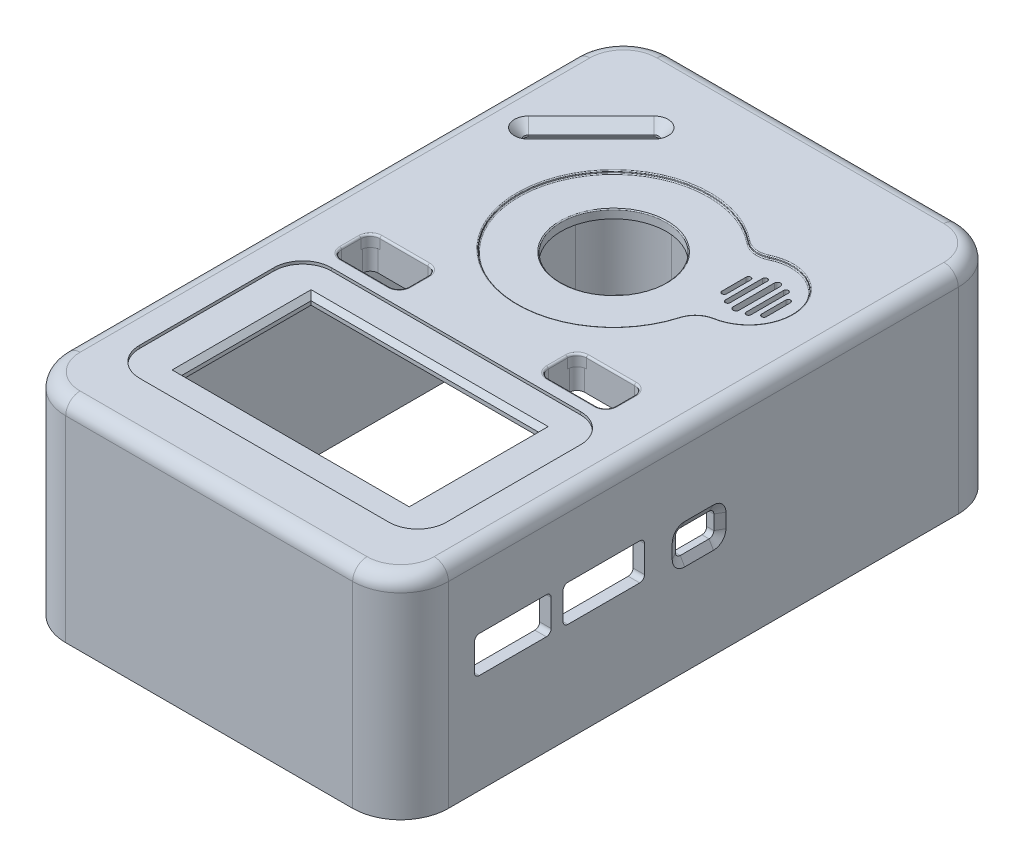
from build123d import *

# Parameters (mm, degrees)
SKETCH_1_W              = 39.94
SKETCH_1_H              = 63.19
EXTRUDE_1_DEPTH         = 22
SHELL_1_T               = -1.2
SKETCH_2_R              = 2.25
SKETCH_2_R_2            = 1.5
EXTRUDE_2_DEPTH         = 5.9
SKETCH_3_R              = 5.5
CUT_EXTRUDE_2_DEPTH     = 43.774816481
SKETCH_4_W              = 7
SKETCH_4_H              = 4
CUT_EXTRUDE_1228_DEPTH  = 44.371014803
SKETCH_5_W              = 8
SKETCH_5_H              = 3.8
SKETCH_5_W_2            = 8.5
SWD_DEPTH               = 10
FILLET_4_R              = 5
FILLET_5_R              = 1.5
FILLET_7_R              = 0.5
CUT_EXTRUDE_6_DEPTH     = 2
CHAMFER_1_SIZE          = 1
CUT_EXTRUDE_9_DEPTH     = 1.2
CUT_EXTRUDE_13_DEPTH    = 1.2
FILLET_8_R              = 1
CUT_EXTRUDE_14_DEPTH    = 1.2
SKETCH_21_R             = 4.003359422
SKETCH_21_R_2           = 3.473256356
EXTRUDE_4_DEPTH         = 3
CUT_EXTRUDE_15_DEPTH    = 0.3
FILLET_9_R              = 0.1
FILLET_10_R             = 0.2
EXTRUDE_5_DEPTH         = 3
CHAMFER_3_SIZE          = 0.141061585
CHAMFER_3_SIZE_2        = 0.8
SKETCH_37_W             = 32
SKETCH_37_H             = 20
SKETCH_37_W_2           = 23.74
SKETCH_37_H_2           = 13.5
CUT_EXTRUDE_10086_DEPTH = 0.3
FILLET_11_R             = 3
SKETCH_38_W             = 23.74
SKETCH_38_H             = 13.5
CUT_EXTRUDE_18_DEPTH    = 44.371014875
CHAMFER_4_SIZE          = 0.5
FILLET_12_R             = 0.5
SKETCH_39_W             = 4
SKETCH_39_H             = 2.5
CUT_EXTRUDE_11267_DEPTH = 1.2
FILLET_13_R             = 0.5
CHAMFER_5_SIZE          = 0.8
CHAMFER_5_SIZE2         = 0.461880215
SKETCH_40_W             = 8
SKETCH_40_H             = 5
SKETCH_40_W_2           = 7
SKETCH_40_H_2           = 4
EXTRUDE_6_DEPTH         = 2.2
FILLET_14_R             = 0.8
FILLET_15_R             = 0.8
CUT_EXTRUDE_22_DEPTH    = 72.001181358
CHAMFER_9_SIZE          = 1.430104311
CHAMFER_9_SIZE2         = 1.2
CHAMFER_10_SIZE         = 1.2
CHAMFER_10_SIZE2        = 1.430104311


with BuildPart() as part:
    # 草图1 → 凸台-拉伸1 (new body)
    with BuildSketch(Plane(origin=(0, 0, 0), x_dir=(1, 0, 0), z_dir=(0, 1, 0))):
        Rectangle(SKETCH_1_W, SKETCH_1_H)
    extrude(amount=EXTRUDE_1_DEPTH)

    # 抽壳1
    shell_1_openings = [part.faces().sort_by_distance(p)[0] for p in [
        (0, 0, 0),
    ]]
    offset(amount=SHELL_1_T, openings=shell_1_openings, kind=Kind.INTERSECTION)

    # 草图2 → 凸台-拉伸2 (add)
    # profile 1 of 3: a face of its own
    with BuildSketch(Plane.XZ.offset(-20.8)):
        with Locations(Location((-14.97, 23.095, 0), (0, 0, 270))):
            Circle(SKETCH_2_R)
        with Locations(Location((-14.97, 23.095, 0), (0, 0, 270))):
            Circle(SKETCH_2_R_2, mode=Mode.SUBTRACT)
    # profile 2 of 3: a face of its own
    with BuildSketch(Plane.XZ.offset(-20.8)):
        with Locations(Location((-14.97, -23.115, 0), (0, 0, 270))):
            Circle(SKETCH_2_R)
        with Locations(Location((-14.97, -23.115, 0), (0, 0, 270))):
            Circle(SKETCH_2_R_2, mode=Mode.SUBTRACT)
    # profile 3 of 3: a face of its own
    with BuildSketch(Plane.XZ.offset(-20.8)):
        with Locations(Location((14.98, -23.115, 0), (0, 0, 270))):
            Circle(SKETCH_2_R)
        with Locations(Location((14.98, -23.115, 0), (0, 0, 270))):
            Circle(SKETCH_2_R_2, mode=Mode.SUBTRACT)
    extrude(amount=EXTRUDE_2_DEPTH)

    # 草图3 → 切除-拉伸2 (cut, through all)
    with BuildSketch(Plane(origin=(0, 20.8, 0), x_dir=(-1, 0, 0), z_dir=(0, -1, 0))):
        with Locations(Location((0, 10.602, 0), (0, 0, 90))):
            Circle(SKETCH_3_R)
    extrude(amount=-CUT_EXTRUDE_2_DEPTH, mode=Mode.SUBTRACT)

    # 草图4 → Cut-Extrude 1228 (cut, through all)
    with BuildSketch(Plane(origin=(0, 22, 0), x_dir=(1, 0, 0), z_dir=(0, 1, 0))):
        with Locations((10.78218, -2.49486)):
            Rectangle(SKETCH_4_W, SKETCH_4_H)
        with Locations((-10.78218, -2.49486)):
            Rectangle(SKETCH_4_W, SKETCH_4_H)
    extrude(amount=-CUT_EXTRUDE_1228_DEPTH, mode=Mode.SUBTRACT)

    # 草图5 → swd (cut)
    with BuildSketch(Plane(origin=(19.97, 0, 0), x_dir=(0, 0, -1), z_dir=(1, 0, 0))):
        with Locations((-19.885, 12.3)):
            Rectangle(SKETCH_5_W, SKETCH_5_H)
        with Locations((-10.395, 12.3)):
            Rectangle(SKETCH_5_W_2, SKETCH_5_H)
    extrude(amount=-SWD_DEPTH, mode=Mode.SUBTRACT)

    # 圆角4
    fillet_4_edges = [part.edges().sort_by_distance(p)[0] for p in [
        (18.77, 10.4, 30.395),
        (18.77, 10.4, -30.395),
        (-18.77, 10.4, -30.395),
        (-18.77, 10.4, 30.395),
        (19.97, 11, 31.595),
        (-19.97, 11, 31.595),
        (-19.97, 11, -31.595),
        (19.97, 11, -31.595),
    ]]
    fillet(fillet_4_edges, radius=FILLET_4_R)

    # 圆角5
    fillet_5_edges = [part.edges().sort_by_distance(p)[0] for p in [
        (18.77, 20.8, 0),
        (0, 20.8, -30.395),
        (0, 20.8, 30.395),
        (-18.77, 20.8, 0),
        (-17.305533906, 20.8, 28.930533906),
        (17.305533906, 20.8, 28.930533906),
        (-17.305533906, 20.8, -28.930533906),
        (17.305533906, 20.8, -28.930533906),
        (0, 22, -31.595),
        (19.97, 22, 0),
        (-19.97, 22, 0),
        (0, 22, 31.595),
        (18.505533906, 22, 30.130533906),
        (-18.505533906, 22, 30.130533906),
        (-18.505533906, 22, -30.130533906),
        (18.505533906, 22, -30.130533906),
    ]]
    fillet(fillet_5_edges, radius=FILLET_5_R)

    # 圆角7
    fillet_7_edges = [part.edges().sort_by_distance(p)[0] for p in [
        (19.37, 14.2, 15.885),
        (19.37, 10.4, 15.885),
        (19.37, 10.4, 23.885),
        (19.37, 14.2, 23.885),
    ]]
    fillet(fillet_7_edges, radius=FILLET_7_R)

    # 草图7 → 切除-拉伸6 (cut)
    with BuildSketch(Plane(origin=(0, 22, 0), x_dir=(1, 0, 0), z_dir=(0, 1, 0))):
        with BuildLine():
            Line((-15.710868493, 17.443795475), (-9.170498178, 23.984165789))
            ThreePointArc((-9.170498178, 23.984165789), (-8.493843211, 23.984165789), (-8.493843211, 23.307510822))
            Line((-8.493843211, 23.307510822), (-15.034213525, 16.767140507))
            ThreePointArc((-15.034213525, 16.767140507), (-15.710868493, 16.767140507), (-15.710868493, 17.443795475))
        make_face()
    extrude(amount=-CUT_EXTRUDE_6_DEPTH, mode=Mode.SUBTRACT)

    # 倒角1
    chamfer_1_edges = [part.edges().sort_by_distance(p)[0] for p in [
        (-15.710868493, 22, -16.767140507),
        (-11.764028368, 22, -20.037325665),
        (-8.493843211, 22, -23.984165789),
        (-12.440683335, 22, -20.713980632),
    ]]
    chamfer(chamfer_1_edges, length=CHAMFER_1_SIZE)

    # 草图9 → 切除-拉伸9 (cut)
    with BuildSketch(Plane(origin=(0, 22, 0), x_dir=(1, 0, 0), z_dir=(0, 1, 0))):
        with BuildLine():
            Line((11.195444129, 11.881592207), (11.195444129, 16.185123176))
            ThreePointArc((11.195444129, 16.185123176), (11.507696947, 16.497375994), (11.819949765, 16.185123176))
            Line((11.819949765, 16.185123176), (11.819949765, 11.881592207))
            ThreePointArc((11.819949765, 11.881592207), (11.507696947, 11.569339388), (11.195444129, 11.881592207))
        make_face()
    extrude(amount=-CUT_EXTRUDE_9_DEPTH, mode=Mode.SUBTRACT)

    # 草图11 → 切除-拉伸13 (cut)
    with BuildSketch(Plane(origin=(0, 22, 0), x_dir=(1, 0, 0), z_dir=(0, 1, 0))):
        with BuildLine():
            Line((10.167500669, 12.090149524), (10.167500669, 15.990149524))
            ThreePointArc((10.167500669, 15.990149524), (10.417500669, 16.240149524), (10.667500669, 15.990149524))
            Line((10.667500669, 15.990149524), (10.667500669, 12.090149524))
            ThreePointArc((10.667500669, 12.090149524), (10.417500669, 11.840149524), (10.167500669, 12.090149524))
        make_face()
        with BuildLine():
            Line((12.847893225, 12.090149524), (12.847893225, 15.990149524))
            ThreePointArc((12.847893225, 15.990149524), (12.597893225, 16.240149524), (12.347893225, 15.990149524))
            Line((12.347893225, 15.990149524), (12.347893225, 12.090149524))
            ThreePointArc((12.347893225, 12.090149524), (12.597893225, 11.840149524), (12.847893225, 12.090149524))
        make_face()
    extrude(amount=-CUT_EXTRUDE_13_DEPTH, mode=Mode.SUBTRACT)

    # 圆角8
    fillet_8_edges = [part.edges().sort_by_distance(p)[0] for p in [
        (7.28218, 21.4, 4.49486),
        (7.28218, 21.4, 0.49486),
        (14.28218, 21.4, 0.49486),
        (14.28218, 21.4, 4.49486),
        (-14.28218, 21.4, 4.49486),
        (-14.28218, 21.4, 0.49486),
        (-7.28218, 21.4, 0.49486),
        (-7.28218, 21.4, 4.49486),
    ]]
    fillet(fillet_8_edges, radius=FILLET_8_R)

    # 草图14 → 切除-拉伸14 (cut)
    with BuildSketch(Plane(origin=(0, 22, 0), x_dir=(1, 0, 0), z_dir=(0, 1, 0))):
        with BuildLine():
            Line((9.19032227, 12.708953483), (9.19032227, 15.237110605))
            ThreePointArc((9.19032227, 15.237110605), (9.438180812, 15.484969146), (9.686039353, 15.237110605))
            Line((9.686039353, 15.237110605), (9.686039353, 12.708953483))
            ThreePointArc((9.686039353, 12.708953483), (9.438180812, 12.461094942), (9.19032227, 12.708953483))
        make_face()
        with BuildLine():
            Line((13.825071623, 12.708953483), (13.825071623, 15.237110605))
            ThreePointArc((13.825071623, 15.237110605), (13.577213082, 15.484969146), (13.329354541, 15.237110605))
            Line((13.329354541, 15.237110605), (13.329354541, 12.708953483))
            ThreePointArc((13.329354541, 12.708953483), (13.577213082, 12.461094942), (13.825071623, 12.708953483))
        make_face()
    extrude(amount=-CUT_EXTRUDE_14_DEPTH, mode=Mode.SUBTRACT)

    # 草图21 → 凸台-拉伸4 (add)
    with BuildSketch(Plane.XZ.offset(-20.8)):
        with Locations(Location((11.482348842, -14.033357691, 0), (0, 0, 270))):
            Circle(SKETCH_21_R)
        with Locations(Location((11.482348842, -14.033357691, 0), (0, 0, 270))):
            Circle(SKETCH_21_R_2, mode=Mode.SUBTRACT)
    extrude(amount=EXTRUDE_4_DEPTH)

    # 草图28 → 切除-拉伸15 (cut)
    with BuildSketch(Plane(origin=(0, 22, 0), x_dir=(1, 0, 0), z_dir=(0, 1, 0))):
        with BuildLine():
            ThreePointArc((11.528895597, 9.570062904), (15.014572547, 15.38266374), (8.786694992, 18.056577245))
            ThreePointArc((8.786694992, 18.056577245), (7.511521234, 17.845174605), (6.321720035, 18.350280829))
            ThreePointArc((6.321720035, 18.350280829), (-9.543831568, 7.616153555), (9.610486686, 7.838208102))
            ThreePointArc((9.610486686, 7.838208102), (10.32235967, 8.978109336), (11.528895597, 9.570062904))
        make_face()
    extrude(amount=-CUT_EXTRUDE_15_DEPTH, mode=Mode.SUBTRACT)

    # 圆角9
    fillet_9_edges = [part.edges().sort_by_distance(p)[0] for p in [
        (0, 21.7, -5.102),
        (7.511521234, 22, -17.845174605),
        (-9.543831568, 22, -7.616153555),
        (10.32235967, 22, -8.978109336),
        (15.014572547, 22, -15.38266374),
        (7.511521234, 21.7, -17.845174605),
        (15.014572547, 21.7, -15.38266374),
        (10.32235967, 21.7, -8.978109336),
        (-9.543831568, 21.7, -7.616153555),
    ]]
    fillet(fillet_9_edges, radius=FILLET_9_R)

    # 圆角10
    fillet_10_edges = [part.edges().sort_by_distance(p)[0] for p in [
        (10.78218, 22, 0.49486),
        (14.28218, 22, 2.49486),
        (7.28218, 22, 2.49486),
        (10.78218, 22, 4.49486),
        (-14.28218, 22, 2.49486),
        (-10.78218, 22, 0.49486),
        (-7.28218, 22, 2.49486),
        (-10.78218, 22, 4.49486),
        (13.989286781, 22, 0.787753219),
        (7.575073219, 22, 0.787753219),
        (7.575073219, 22, 4.201966781),
        (13.989286781, 22, 4.201966781),
        (-13.989286781, 22, 0.787753219),
        (-7.575073219, 22, 0.787753219),
        (-7.575073219, 22, 4.201966781),
        (-13.989286781, 22, 4.201966781),
    ]]
    fillet(fillet_10_edges, radius=FILLET_10_R)

    # 草图29 → 凸台-拉伸5 (add)
    with BuildSketch(Plane.XZ.offset(-20.8)):
        with BuildLine():
            Line((-14.82513277, -15.881404785), (-7.608107488, -23.098430067))
            ThreePointArc((-7.608107488, -23.098430067), (-7.608107488, -24.869901512), (-9.379578933, -24.869901512))
            Line((-9.379578933, -24.869901512), (-16.596604215, -17.65287623))
            ThreePointArc((-16.596604215, -17.65287623), (-16.596604215, -15.881404785), (-14.82513277, -15.881404785))
        make_face()
        with BuildLine():
            Line((-15.082047517, -16.138319531), (-7.865022235, -23.355344814))
            ThreePointArc((-7.865022235, -23.355344814), (-7.865022235, -24.612986765), (-9.122664186, -24.612986765))
            Line((-9.122664186, -24.612986765), (-16.339689469, -17.395961483))
            ThreePointArc((-16.339689469, -17.395961483), (-16.339689469, -16.138319531), (-15.082047517, -16.138319531))
        make_face(mode=Mode.SUBTRACT)
    extrude(amount=EXTRUDE_5_DEPTH)

    # 倒角3
    # the kernel refuses this chamfer: 0.8, 0.141061585 mm, written as the material it takes off along each edge
    with BuildSketch(Plane(origin=(-8.493843211, 17.8, -23.984165789), x_dir=(0.7071067811865506, 0, 0.7071067811865446), z_dir=(-0.7071067811865446, 0, 0.7071067811865506))) as chamfer_3_piece_1:
        Polygon((0.889287152, CHAMFER_3_SIZE * 0.999999996929), (0.889287152 + CHAMFER_3_SIZE_2, 0), (0.889287152, 0), align=None)
    revolve(axis=Axis((-8.493843211, 17.8, -23.984165789), (0, 1, 0)), revolution_arc=180, mode=Mode.SUBTRACT)
    with BuildSketch(Plane(origin=(-9.122664186, 17.8, -24.612986765), x_dir=(0.14859054272879452, 0.9776715712462568, 0.14859054272879438), z_dir=(-0.7071067811865472, 0, 0.7071067811865479)), Plane(origin=(-15.082047517, 17.8, -16.138319531), x_dir=(-0.14859054272879452, 0.9776715712462568, -0.14859054272879435), z_dir=(0.7071067811865471, 0, -0.7071067811865479))) as chamfer_3_piece_2:
        Polygon((CHAMFER_3_SIZE * 0.977671568244, CHAMFER_3_SIZE * 0.210138760122), (-CHAMFER_3_SIZE_2 * 0.210138760767, CHAMFER_3_SIZE_2 * 0.977671571246), (0, 0), align=None)
    extrude(amount=10.206415034, mode=Mode.SUBTRACT)
    with BuildSketch(Plane(origin=(-15.710868493, 17.8, -16.767140507), x_dir=(-0.7071067811865466, 0, -0.7071067811865486), z_dir=(0.7071067811865486, 0, -0.7071067811865466))) as chamfer_3_piece_3:
        Polygon((0.889287152, CHAMFER_3_SIZE * 0.999999996929), (0.889287152 + CHAMFER_3_SIZE_2, 0), (0.889287152, 0), align=None)
    revolve(axis=Axis((-15.710868493, 17.8, -16.767140507), (0, 1, 0)), revolution_arc=180, mode=Mode.SUBTRACT)

    # 草图37 → Cut-Extrude 10086 (cut)
    with BuildSketch(Plane(origin=(0, 22, 0), x_dir=(1, 0, 0), z_dir=(0, 1, 0))):
        with Locations((0, -15.845)):
            Rectangle(SKETCH_37_W, SKETCH_37_H)
        with Locations((0, -15.845)):
            Rectangle(SKETCH_37_W_2, SKETCH_37_H_2, mode=Mode.SUBTRACT)
    extrude(amount=-CUT_EXTRUDE_10086_DEPTH, mode=Mode.SUBTRACT)

    # 圆角11
    fillet_11_edges = [part.edges().sort_by_distance(p)[0] for p in [
        (-16, 21.85, 25.845),
        (-16, 21.85, 5.845),
        (16, 21.85, 5.845),
        (16, 21.85, 25.845),
    ]]
    fillet(fillet_11_edges, radius=FILLET_11_R)

    # 草图38 → 切除-拉伸18 (cut, through all)
    with BuildSketch(Plane(origin=(0, 22, 0), x_dir=(1, 0, 0), z_dir=(0, 1, 0))):
        with Locations((0, -15.845)):
            Rectangle(SKETCH_38_W, SKETCH_38_H)
    extrude(amount=-CUT_EXTRUDE_18_DEPTH, mode=Mode.SUBTRACT)

    # 倒角4
    chamfer_4_edges = [part.edges().sort_by_distance(p)[0] for p in [
        (0, 21.7, 9.095),
        (-11.87, 21.7, 15.845),
        (0, 21.7, 22.595),
        (11.87, 21.7, 15.845),
    ]]
    chamfer(chamfer_4_edges, length=CHAMFER_4_SIZE)

    # 圆角12
    fillet_12_edges = [part.edges().sort_by_distance(p)[0] for p in [
        (19.37, 14.2, 6.145),
        (19.37, 10.4, 6.145),
        (19.37, 10.4, 14.645),
        (19.37, 14.2, 14.645),
    ]]
    fillet(fillet_12_edges, radius=FILLET_12_R)

    # 草图39 → Cut-Extrude 11267 (cut)
    with BuildSketch(Plane(origin=(19.97, 0, 0), x_dir=(0, 0, -1), z_dir=(1, 0, 0))):
        with Locations((-0.45095135, 11.55)):
            Rectangle(SKETCH_39_W, SKETCH_39_H)
    extrude(amount=-CUT_EXTRUDE_11267_DEPTH, mode=Mode.SUBTRACT)

    # 圆角13
    fillet_13_edges = [part.edges().sort_by_distance(p)[0] for p in [
        (19.37, 12.8, -1.54904865),
        (19.37, 10.3, -1.54904865),
        (19.37, 10.3, 2.45095135),
        (19.37, 12.8, 2.45095135),
    ]]
    fillet(fillet_13_edges, radius=FILLET_13_R)

    # 倒角5
    chamfer_5_edges = [part.edges().sort_by_distance(p)[0] for p in [
        (19.97, 12.8, 0.45095135),
        (19.97, 11.55, -1.54904865),
        (19.97, 10.3, 0.45095135),
        (19.97, 11.55, 2.45095135),
        (19.97, 12.653553391, -1.402602041),
        (19.97, 10.446446609, -1.402602041),
        (19.97, 10.446446609, 2.304504741),
        (19.97, 12.653553391, 2.304504741),
    ]]
    chamfer_5_side = [part.faces().sort_by_distance(p)[0] for p in [
        (19.97, 10.112151821, -0.921281886),
    ]]
    chamfer(chamfer_5_edges, length=CHAMFER_5_SIZE, length2=CHAMFER_5_SIZE2, reference=chamfer_5_side[0])

    # 草图40 → 凸台-拉伸6 (add)
    # profile 1 of 2: a face of its own
    with BuildSketch(Plane.XZ.offset(-20.8)):
        with Locations((-10.78218, 2.49486)):
            Rectangle(SKETCH_40_W, SKETCH_40_H)
        with Locations((-10.78218, 2.49486)):
            Rectangle(SKETCH_40_W_2, SKETCH_40_H_2, mode=Mode.SUBTRACT)
    # profile 2 of 2: a face of its own
    with BuildSketch(Plane.XZ.offset(-20.8)):
        with Locations((10.78218, 2.49486)):
            Rectangle(SKETCH_40_W, SKETCH_40_H)
        with Locations((10.78218, 2.49486)):
            Rectangle(SKETCH_40_W_2, SKETCH_40_H_2, mode=Mode.SUBTRACT)
    extrude(amount=EXTRUDE_6_DEPTH)

    # 圆角14
    fillet_14_edges = [part.edges().sort_by_distance(p)[0] for p in [
        (-6.78218, 19.7, -0.00514),
        (-6.78218, 19.7, 4.99486),
        (-14.78218, 19.7, 4.99486),
        (-14.78218, 19.7, -0.00514),
        (-7.28218, 19.7, 4.49486),
        (-14.28218, 19.7, 4.49486),
        (-14.28218, 19.7, 0.49486),
        (-7.28218, 19.7, 0.49486),
    ]]
    fillet(fillet_14_edges, radius=FILLET_14_R)

    # 圆角15
    fillet_15_edges = [part.edges().sort_by_distance(p)[0] for p in [
        (14.78218, 19.7, -0.00514),
        (14.78218, 19.7, 4.99486),
        (6.78218, 19.7, 4.99486),
        (6.78218, 19.7, -0.00514),
        (7.28218, 19.7, 4.49486),
        (7.28218, 19.7, 0.49486),
        (14.28218, 19.7, 0.49486),
        (14.28218, 19.7, 4.49486),
    ]]
    fillet(fillet_15_edges, radius=FILLET_15_R)

    # Sketch 3D_9 → 切除-拉伸22 (cut, through all, along a direction that is not the sketch's normal)
    with BuildSketch(Plane(origin=(-16.751307749, 8.192548867, -27.413692251), x_dir=(0.2834326041895312, 0.9161505977538402, -0.2834326041894651), z_dir=(-0.7071067811864651, 0, -0.70710678118663))):
        Polygon((0, 0), (0.506136717, 1.156830974), (1.628870738, 0.665612357), (1.122734021, -0.491218617), align=None)
        Polygon((1.521330038, -0.665612357), (2.027466755, 0.491218617), (3.150200775, 0), (2.644064058, -1.156830974), align=None)
    extrude(amount=CUT_EXTRUDE_22_DEPTH, dir=(-0.7499938698186965, 0, -0.6614447786734551), mode=Mode.SUBTRACT)

    # 倒角9
    chamfer_9_edges = [part.edges().sort_by_distance(p)[0] for p in [
        (-18.675703654, 11.078607191, -29.95174849),
    ]]
    chamfer_9_side = [part.faces().sort_by_distance(p)[0] for p in [
        (-18.028875036, 11.078607191, -29.382805924),
    ]]
    chamfer(chamfer_9_edges, length=CHAMFER_9_SIZE, length2=CHAMFER_9_SIZE2, reference=chamfer_9_side[0])

    # 倒角10
    chamfer_10_edges = [part.edges().sort_by_distance(p)[0] for p in [
        (-18.675703654, 8.192548867, -29.95174849),
    ]]
    chamfer_10_side = [part.faces().sort_by_distance(p)[0] for p in [
        (-18.028875036, 8.192548867, -29.382805924),
    ]]
    chamfer(chamfer_10_edges, length=CHAMFER_10_SIZE, length2=CHAMFER_10_SIZE2, reference=chamfer_10_side[0])


solid = part.part
